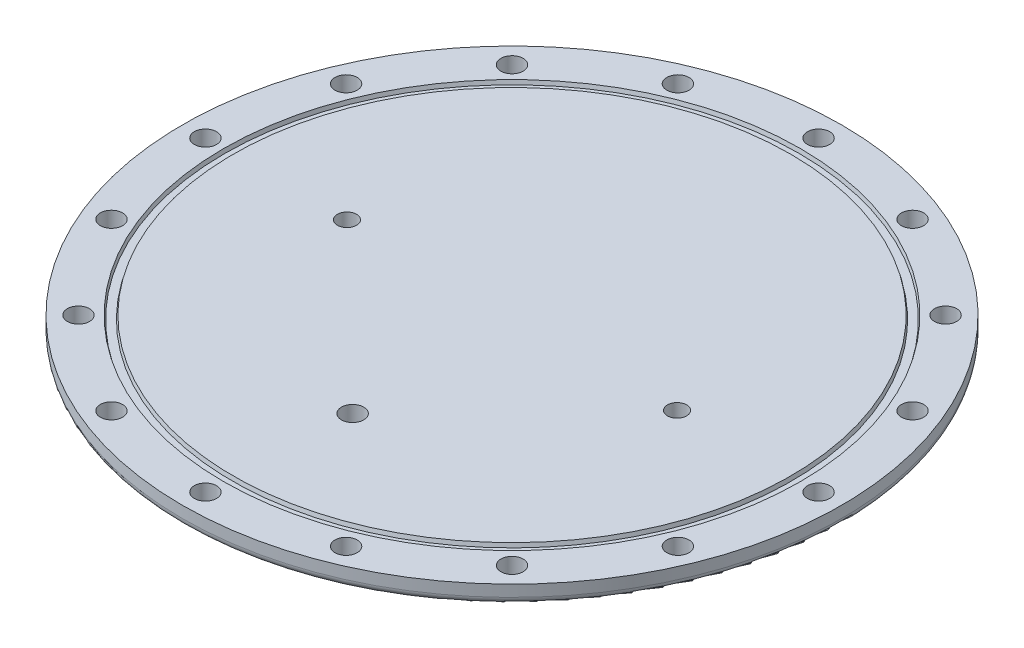
from build123d import *

# Parameters (mm, degrees)
SKETCH1_R           = 86
BOSS_EXTRUDE1_DEPTH = 5
CUT_EXTRUDE1_REACH  = 123.725
SKETCH2_R           = 2.9
CUT_EXTRUDE2_REACH  = 123.725
SKETCH5_R           = 2.5
SKETCH5_R_2         = 2.9
FILLET1_R           = 2


with BuildPart() as part:
    # Sketch1 → Boss-Extrude1 (new body)
    with BuildSketch(Plane(origin=(0, 0, 0), x_dir=(1, 0, 0), z_dir=(0, 1, 0))):
        Circle(SKETCH1_R)
    extrude(amount=BOSS_EXTRUDE1_DEPTH)

    # Sketch2 → Cut-Extrude1 (cut, up to next)
    with BuildSketch(Plane(origin=(0, 5, 0), x_dir=(1, 0, 0), z_dir=(0, 1, 0)), mode=Mode.PRIVATE) as cut_extrude1_sk1:
        with Locations((0, 80)):
            Circle(SKETCH2_R)
    cut_extrude1_tool1 = extrude(cut_extrude1_sk1.sketch, amount=-CUT_EXTRUDE1_REACH, mode=Mode.PRIVATE) & part.part
    # Sketch2 → Cut-Extrude1 (cut, up to next)
    with BuildSketch(Plane(origin=(0, 5, 0), x_dir=(1, 0, 0), z_dir=(0, 1, 0)), mode=Mode.PRIVATE) as cut_extrude1_sk2:
        with Locations((30.614674589, 73.910362601)):
            Circle(SKETCH2_R)
    cut_extrude1_tool2 = extrude(cut_extrude1_sk2.sketch, amount=-CUT_EXTRUDE1_REACH, mode=Mode.PRIVATE) & part.part
    # Sketch2 → Cut-Extrude1 (cut, up to next)
    with BuildSketch(Plane(origin=(0, 5, 0), x_dir=(1, 0, 0), z_dir=(0, 1, 0)), mode=Mode.PRIVATE) as cut_extrude1_sk3:
        with Locations((56.568542495, 56.568542495)):
            Circle(SKETCH2_R)
    cut_extrude1_tool3 = extrude(cut_extrude1_sk3.sketch, amount=-CUT_EXTRUDE1_REACH, mode=Mode.PRIVATE) & part.part
    # Sketch2 → Cut-Extrude1 (cut, up to next)
    with BuildSketch(Plane(origin=(0, 5, 0), x_dir=(1, 0, 0), z_dir=(0, 1, 0)), mode=Mode.PRIVATE) as cut_extrude1_sk4:
        with Locations((73.910362601, 30.614674589)):
            Circle(SKETCH2_R)
    cut_extrude1_tool4 = extrude(cut_extrude1_sk4.sketch, amount=-CUT_EXTRUDE1_REACH, mode=Mode.PRIVATE) & part.part
    # Sketch2 → Cut-Extrude1 (cut, up to next)
    with BuildSketch(Plane(origin=(0, 5, 0), x_dir=(1, 0, 0), z_dir=(0, 1, 0)), mode=Mode.PRIVATE) as cut_extrude1_sk5:
        with Locations((80, 0)):
            Circle(SKETCH2_R)
    cut_extrude1_tool5 = extrude(cut_extrude1_sk5.sketch, amount=-CUT_EXTRUDE1_REACH, mode=Mode.PRIVATE) & part.part
    # Sketch2 → Cut-Extrude1 (cut, up to next)
    with BuildSketch(Plane(origin=(0, 5, 0), x_dir=(1, 0, 0), z_dir=(0, 1, 0)), mode=Mode.PRIVATE) as cut_extrude1_sk6:
        with Locations((73.910362601, -30.614674589)):
            Circle(SKETCH2_R)
    cut_extrude1_tool6 = extrude(cut_extrude1_sk6.sketch, amount=-CUT_EXTRUDE1_REACH, mode=Mode.PRIVATE) & part.part
    # Sketch2 → Cut-Extrude1 (cut, up to next)
    with BuildSketch(Plane(origin=(0, 5, 0), x_dir=(1, 0, 0), z_dir=(0, 1, 0)), mode=Mode.PRIVATE) as cut_extrude1_sk7:
        with Locations((56.568542495, -56.568542495)):
            Circle(SKETCH2_R)
    cut_extrude1_tool7 = extrude(cut_extrude1_sk7.sketch, amount=-CUT_EXTRUDE1_REACH, mode=Mode.PRIVATE) & part.part
    # Sketch2 → Cut-Extrude1 (cut, up to next)
    with BuildSketch(Plane(origin=(0, 5, 0), x_dir=(1, 0, 0), z_dir=(0, 1, 0)), mode=Mode.PRIVATE) as cut_extrude1_sk8:
        with Locations((30.614674589, -73.910362601)):
            Circle(SKETCH2_R)
    cut_extrude1_tool8 = extrude(cut_extrude1_sk8.sketch, amount=-CUT_EXTRUDE1_REACH, mode=Mode.PRIVATE) & part.part
    # Sketch2 → Cut-Extrude1 (cut, up to next)
    with BuildSketch(Plane(origin=(0, 5, 0), x_dir=(1, 0, 0), z_dir=(0, 1, 0)), mode=Mode.PRIVATE) as cut_extrude1_sk9:
        with Locations((0, -80)):
            Circle(SKETCH2_R)
    cut_extrude1_tool9 = extrude(cut_extrude1_sk9.sketch, amount=-CUT_EXTRUDE1_REACH, mode=Mode.PRIVATE) & part.part
    # Sketch2 → Cut-Extrude1 (cut, up to next)
    with BuildSketch(Plane(origin=(0, 5, 0), x_dir=(1, 0, 0), z_dir=(0, 1, 0)), mode=Mode.PRIVATE) as cut_extrude1_sk10:
        with Locations((-30.614674589, -73.910362601)):
            Circle(SKETCH2_R)
    cut_extrude1_tool10 = extrude(cut_extrude1_sk10.sketch, amount=-CUT_EXTRUDE1_REACH, mode=Mode.PRIVATE) & part.part
    # Sketch2 → Cut-Extrude1 (cut, up to next)
    with BuildSketch(Plane(origin=(0, 5, 0), x_dir=(1, 0, 0), z_dir=(0, 1, 0)), mode=Mode.PRIVATE) as cut_extrude1_sk11:
        with Locations((-56.568542495, -56.568542495)):
            Circle(SKETCH2_R)
    cut_extrude1_tool11 = extrude(cut_extrude1_sk11.sketch, amount=-CUT_EXTRUDE1_REACH, mode=Mode.PRIVATE) & part.part
    # Sketch2 → Cut-Extrude1 (cut, up to next)
    with BuildSketch(Plane(origin=(0, 5, 0), x_dir=(1, 0, 0), z_dir=(0, 1, 0)), mode=Mode.PRIVATE) as cut_extrude1_sk12:
        with Locations((-73.910362601, -30.614674589)):
            Circle(SKETCH2_R)
    cut_extrude1_tool12 = extrude(cut_extrude1_sk12.sketch, amount=-CUT_EXTRUDE1_REACH, mode=Mode.PRIVATE) & part.part
    # Sketch2 → Cut-Extrude1 (cut, up to next)
    with BuildSketch(Plane(origin=(0, 5, 0), x_dir=(1, 0, 0), z_dir=(0, 1, 0)), mode=Mode.PRIVATE) as cut_extrude1_sk13:
        with Locations((-80, 0)):
            Circle(SKETCH2_R)
    cut_extrude1_tool13 = extrude(cut_extrude1_sk13.sketch, amount=-CUT_EXTRUDE1_REACH, mode=Mode.PRIVATE) & part.part
    # Sketch2 → Cut-Extrude1 (cut, up to next)
    with BuildSketch(Plane(origin=(0, 5, 0), x_dir=(1, 0, 0), z_dir=(0, 1, 0)), mode=Mode.PRIVATE) as cut_extrude1_sk14:
        with Locations((-73.910362601, 30.614674589)):
            Circle(SKETCH2_R)
    cut_extrude1_tool14 = extrude(cut_extrude1_sk14.sketch, amount=-CUT_EXTRUDE1_REACH, mode=Mode.PRIVATE) & part.part
    # Sketch2 → Cut-Extrude1 (cut, up to next)
    with BuildSketch(Plane(origin=(0, 5, 0), x_dir=(1, 0, 0), z_dir=(0, 1, 0)), mode=Mode.PRIVATE) as cut_extrude1_sk15:
        with Locations((-56.568542495, 56.568542495)):
            Circle(SKETCH2_R)
    cut_extrude1_tool15 = extrude(cut_extrude1_sk15.sketch, amount=-CUT_EXTRUDE1_REACH, mode=Mode.PRIVATE) & part.part
    # Sketch2 → Cut-Extrude1 (cut, up to next)
    with BuildSketch(Plane(origin=(0, 5, 0), x_dir=(1, 0, 0), z_dir=(0, 1, 0)), mode=Mode.PRIVATE) as cut_extrude1_sk16:
        with Locations((-30.614674589, 73.910362601)):
            Circle(SKETCH2_R)
    cut_extrude1_tool16 = extrude(cut_extrude1_sk16.sketch, amount=-CUT_EXTRUDE1_REACH, mode=Mode.PRIVATE) & part.part
    add(cut_extrude1_tool1.solids().sort_by_distance((0, 5, -80))[0], mode=Mode.SUBTRACT)
    add(cut_extrude1_tool2.solids().sort_by_distance((30.614675, 5, -73.910363))[0], mode=Mode.SUBTRACT)
    add(cut_extrude1_tool3.solids().sort_by_distance((56.568542, 5, -56.568542))[0], mode=Mode.SUBTRACT)
    add(cut_extrude1_tool4.solids().sort_by_distance((73.910363, 5, -30.614675))[0], mode=Mode.SUBTRACT)
    add(cut_extrude1_tool5.solids().sort_by_distance((80, 5, 0))[0], mode=Mode.SUBTRACT)
    add(cut_extrude1_tool6.solids().sort_by_distance((73.910363, 5, 30.614675))[0], mode=Mode.SUBTRACT)
    add(cut_extrude1_tool7.solids().sort_by_distance((56.568542, 5, 56.568542))[0], mode=Mode.SUBTRACT)
    add(cut_extrude1_tool8.solids().sort_by_distance((30.614675, 5, 73.910363))[0], mode=Mode.SUBTRACT)
    add(cut_extrude1_tool9.solids().sort_by_distance((0, 5, 80))[0], mode=Mode.SUBTRACT)
    add(cut_extrude1_tool10.solids().sort_by_distance((-30.614675, 5, 73.910363))[0], mode=Mode.SUBTRACT)
    add(cut_extrude1_tool11.solids().sort_by_distance((-56.568542, 5, 56.568542))[0], mode=Mode.SUBTRACT)
    add(cut_extrude1_tool12.solids().sort_by_distance((-73.910363, 5, 30.614675))[0], mode=Mode.SUBTRACT)
    add(cut_extrude1_tool13.solids().sort_by_distance((-80, 5, 0))[0], mode=Mode.SUBTRACT)
    add(cut_extrude1_tool14.solids().sort_by_distance((-73.910363, 5, -30.614675))[0], mode=Mode.SUBTRACT)
    add(cut_extrude1_tool15.solids().sort_by_distance((-56.568542, 5, -56.568542))[0], mode=Mode.SUBTRACT)
    add(cut_extrude1_tool16.solids().sort_by_distance((-30.614675, 5, -73.910363))[0], mode=Mode.SUBTRACT)

    # Sketch5 → Cut-Extrude2 (cut, up to next)
    with BuildSketch(Plane.XZ, mode=Mode.PRIVATE) as cut_extrude2_sk1:
        with Locations((43.064309425, 0)):
            Circle(SKETCH5_R)
    cut_extrude2_tool1 = extrude(cut_extrude2_sk1.sketch, amount=-CUT_EXTRUDE2_REACH, mode=Mode.PRIVATE) & part.part
    # Sketch5 → Cut-Extrude2 (cut, up to next)
    with BuildSketch(Plane.XZ, mode=Mode.PRIVATE) as cut_extrude2_sk2:
        with Locations((-43.064309425, 0)):
            Circle(SKETCH5_R)
    cut_extrude2_tool2 = extrude(cut_extrude2_sk2.sketch, amount=-CUT_EXTRUDE2_REACH, mode=Mode.PRIVATE) & part.part
    # Sketch5 → Cut-Extrude2 (cut, up to next)
    with BuildSketch(Plane.XZ, mode=Mode.PRIVATE) as cut_extrude2_sk3:
        with Locations((1.446676169, 43.040003186)):
            Circle(SKETCH5_R_2)
    cut_extrude2_tool3 = extrude(cut_extrude2_sk3.sketch, amount=-CUT_EXTRUDE2_REACH, mode=Mode.PRIVATE) & part.part
    add(cut_extrude2_tool1.solids().sort_by_distance((43.064309, 0, 0))[0], mode=Mode.SUBTRACT)
    add(cut_extrude2_tool2.solids().sort_by_distance((-43.064309, 0, 0))[0], mode=Mode.SUBTRACT)
    add(cut_extrude2_tool3.solids().sort_by_distance((1.446676, 0, 43.040003))[0], mode=Mode.SUBTRACT)

    # Sketch4 → Cut-Revolve1 (revolve, cut)
    with BuildSketch(Plane.XY):
        Polygon((74, 4), (75, 4), (75.267949192, 5), (72.732050808, 5), (73, 4), align=None)
    revolve(axis=Axis((0, 0, 0), (0, 1, 0)), mode=Mode.SUBTRACT)

    # Fillet1
    fillet1_edges = [part.edges().sort_by_distance(p)[0] for p in [
        (-86, 0, 0),
    ]]
    fillet(fillet1_edges, radius=FILLET1_R)


solid = part.part
